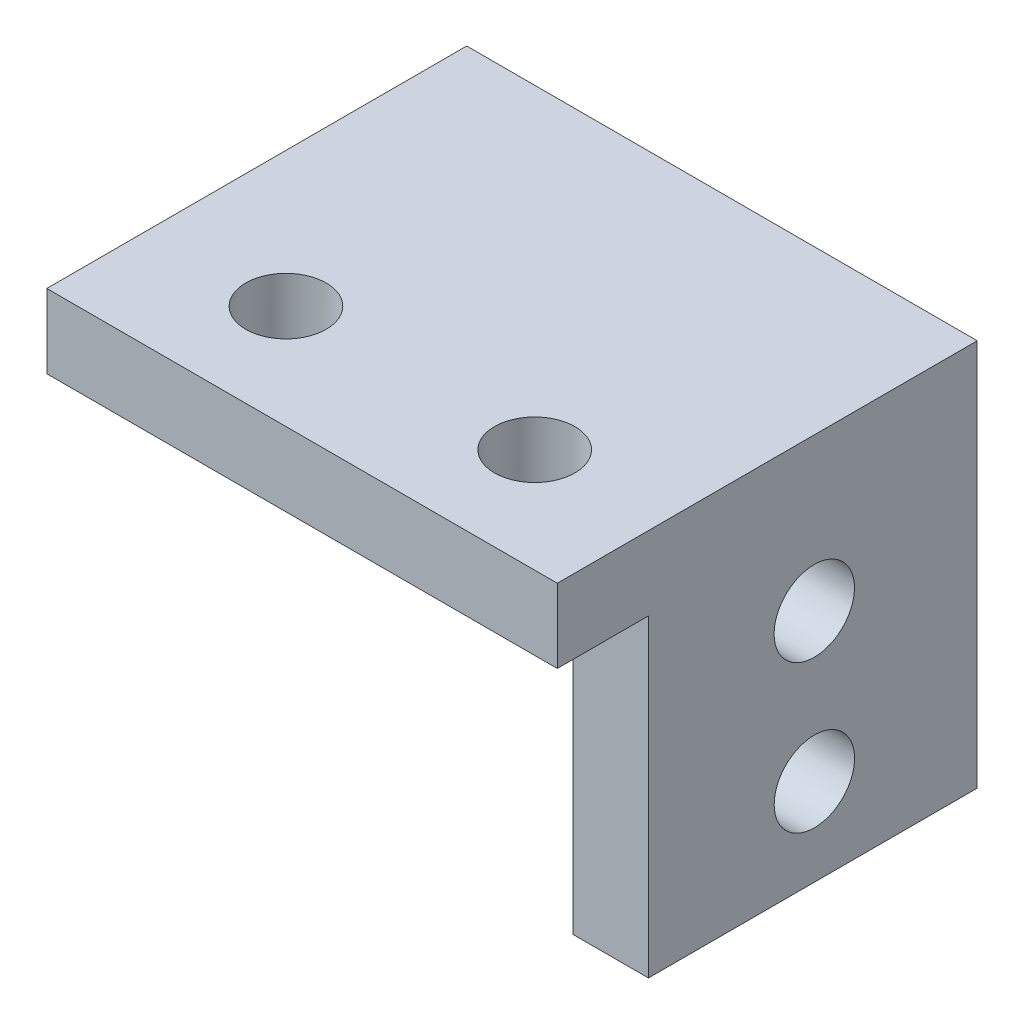
from build123d import *

# Parameters (mm, degrees)
SKETCH1_W           = 20.32
SKETCH1_H           = 20.32
BOSS_EXTRUDE1_DEPTH = 3
SKETCH2_W           = 13.085786438
SKETCH2_H           = 15.522266203
BOSS_EXTRUDE2_DEPTH = 3
SKETCH5_W           = 31.587668609
SKETCH5_H           = 25.562972936
CUT_EXTRUDE1_DEPTH  = 0.1
SKETCH6_W           = 20.32
SKETCH6_H           = 3.606
CUT_EXTRUDE2_DEPTH  = 10
SKETCH7_R           = 1.6
CUT_EXTRUDE3_DEPTH  = 10
SKETCH8_R           = 1.6
CUT_EXTRUDE4_DEPTH  = 10


with BuildPart() as part:
    # Sketch1 → Boss-Extrude1 (new body)
    with BuildSketch(Plane(origin=(0, 0, 0), x_dir=(1, 0, 0), z_dir=(0, 1, 0))):
        with Locations((10.16, 10.16)):
            Rectangle(SKETCH1_W, SKETCH1_H)
    extrude(amount=BOSS_EXTRUDE1_DEPTH)

    # Sketch2 → Boss-Extrude2 (add)
    with BuildSketch(Plane(origin=(20.32, 0, 0), x_dir=(0, 0, -1), z_dir=(1, 0, 0))):
        with Locations((10.171106781, -4.720966496)):
            Rectangle(SKETCH2_W, SKETCH2_H)
    extrude(amount=-BOSS_EXTRUDE2_DEPTH)

    # Sketch5 → Cut-Extrude1 (cut)
    with BuildSketch(Plane(origin=(0, 3.040166606, 0), x_dir=(1, 0, 0), z_dir=(0, 1, 0))):
        with Locations((13.28189867, 9.26803237)):
            Rectangle(SKETCH5_W, SKETCH5_H)
    extrude(amount=-CUT_EXTRUDE1_DEPTH, mode=Mode.SUBTRACT)

    # Sketch6 → Cut-Extrude2 (cut)
    with BuildSketch(Plane(origin=(0, 0, 0), x_dir=(-1, 0, 0), z_dir=(0, -1, 0))):
        with Locations((-10.16, 18.517)):
            Rectangle(SKETCH6_W, SKETCH6_H)
    extrude(amount=-CUT_EXTRUDE2_DEPTH, mode=Mode.SUBTRACT)

    # Sketch7 → Cut-Extrude3 (cut)
    with BuildSketch(Plane(origin=(0, 2.940166606, 0), x_dir=(1, 0, 0), z_dir=(0, 1, 0))):
        with Locations((5.37, 4.15)):
            Circle(SKETCH7_R)
        with Locations((15.27, 4.15)):
            Circle(SKETCH7_R)
    extrude(amount=-CUT_EXTRUDE3_DEPTH, mode=Mode.SUBTRACT)

    # Sketch8 → Cut-Extrude4 (cut)
    with BuildSketch(Plane.ZY.offset(-17.32)):
        with Locations((-10.232213562, -9.006524303)):
            Circle(SKETCH8_R)
        with Locations((-10.228213562, -3.127074003)):
            Circle(SKETCH8_R)
    extrude(amount=-CUT_EXTRUDE4_DEPTH, mode=Mode.SUBTRACT)


solid = part.part
